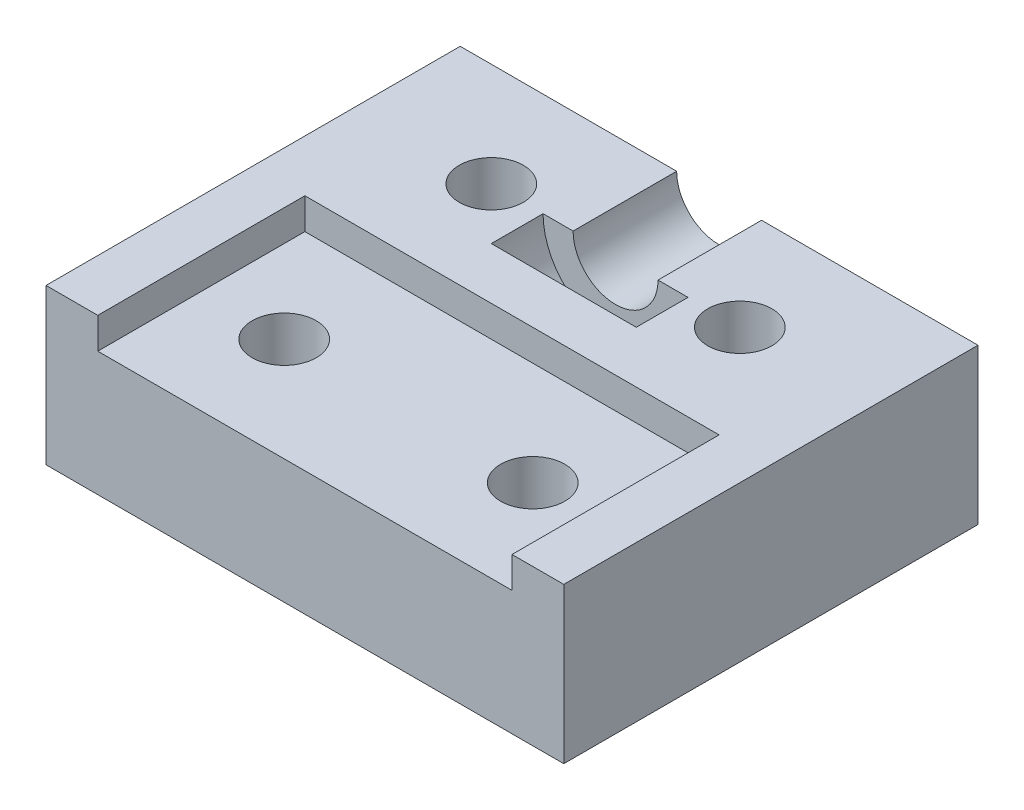
from build123d import *

# Parameters (mm, degrees)
SKETCH2_W                  = 25
SKETCH2_H                  = 20
BOSS_EXTRUDE1_DEPTH        = 7.5
SKETCH3_W                  = 20
SKETCH3_H                  = 3
CUT_EXTRUDE1_DEPTH         = 10
SKETCH4_R                  = 3.5
CUT_EXTRUDE2_DEPTH         = 2.5
SKETCH5_R                  = 2.05
CUT_EXTRUDE3_DEPTH         = 21.916500663
F_3_1_3_1_DIAMETER_HOLE1_D = 3.1
F_3_1_3_1_DIAMETER_HOLE2_D = 3.1


with BuildPart() as part:
    # Sketch2 → Boss-Extrude1 (new body)
    with BuildSketch(Plane(origin=(0, 0, 0), x_dir=(1, 0, 0), z_dir=(0, 1, 0))):
        Rectangle(SKETCH2_W, SKETCH2_H)
    extrude(amount=-BOSS_EXTRUDE1_DEPTH)

    # Sketch3 → Cut-Extrude1 (cut)
    with BuildSketch(Plane.XY.offset(10)):
        Rectangle(SKETCH3_W, SKETCH3_H)
    extrude(amount=-CUT_EXTRUDE1_DEPTH, mode=Mode.SUBTRACT)

    # Sketch4 → Cut-Extrude2 (cut)
    with BuildSketch(Plane.XY.offset(-5)):
        Circle(SKETCH4_R)
    extrude(amount=CUT_EXTRUDE2_DEPTH, mode=Mode.SUBTRACT)

    # Sketch5 → Cut-Extrude3 (cut, through all)
    with BuildSketch(Plane.XY.offset(-5)):
        Circle(SKETCH5_R)
    extrude(amount=-CUT_EXTRUDE3_DEPTH, mode=Mode.SUBTRACT)

    # Ø3.1 (3.1) Diameter Hole1 (through all)
    with Locations(Plane(origin=(0, -1.5, 0), x_dir=(1, 0, 0), z_dir=(0, 1, 0))):
        with Locations((-6, -5), (6, -5)):
            Hole(F_3_1_3_1_DIAMETER_HOLE1_D / 2)

    # Ø3.1 (3.1) Diameter Hole2 (through all)
    with Locations(Plane(origin=(0, 0, 0), x_dir=(1, 0, 0), z_dir=(0, 1, 0))):
        with Locations((-6, 5), (6, 5)):
            Hole(F_3_1_3_1_DIAMETER_HOLE2_D / 2)


solid = part.part
